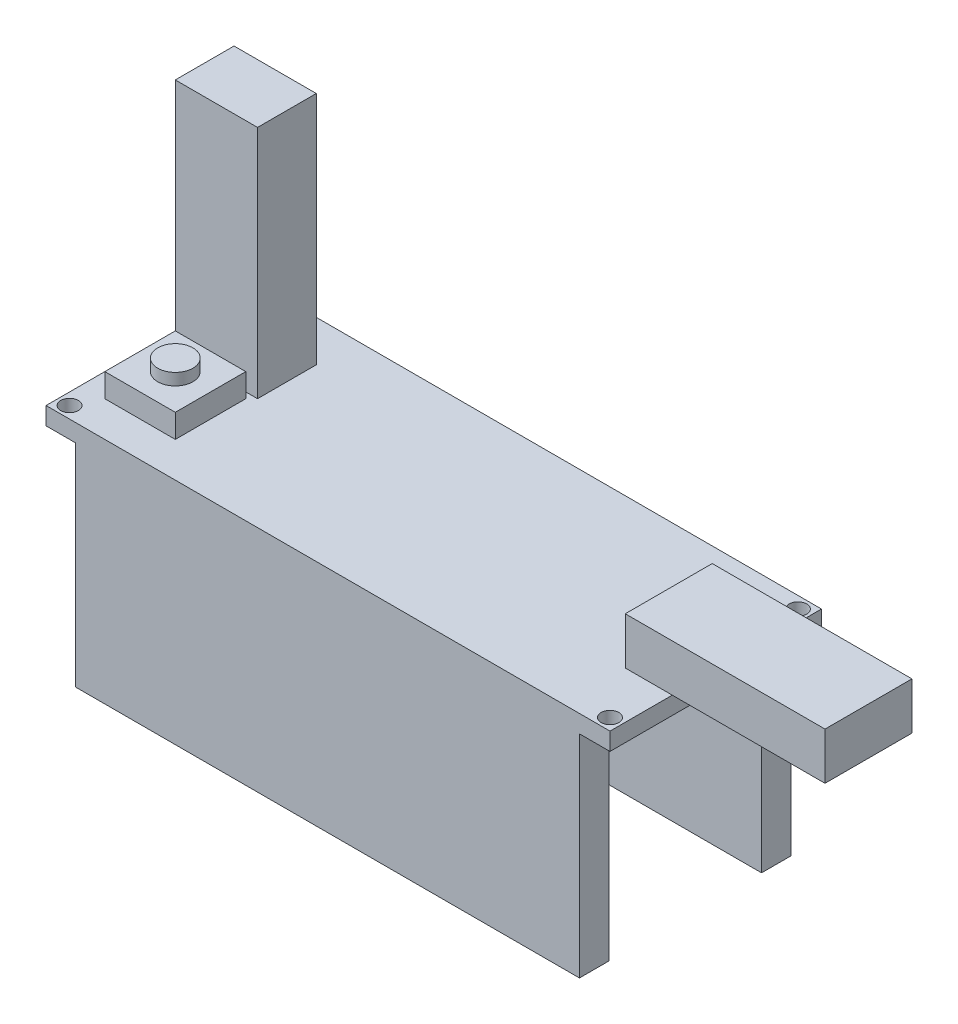
from build123d import *

# Parameters (mm, degrees)
SKETCH_1_W          = 48
SKETCH_1_H          = 18
EXTRUDE_1_DEPTH     = 1.5
SKETCH_2_W          = 17
SKETCH_2_H          = 7.4
EXTRUDE_2_DEPTH     = 4
SKETCH_4_W          = 42.9
SKETCH_4_H          = 2.5
EXTRUDE_3_DEPTH     = 18
SKETCH_5_W          = 7
SKETCH_5_H          = 5
EXTRUDE_4_DEPTH     = 20
SKETCH_6_W          = 6
SKETCH_6_H          = 6
EXTRUDE_5_DEPTH     = 2
SKETCH_7_R          = 1.5
EXTRUDE_6_DEPTH     = 1
SKETCH_8_R          = 0.75
CUT_EXTRUDE_1_DEPTH = 10


with BuildPart() as part:
    # Эскиз1 → Бобышка-Вытянуть1 (new body)
    with BuildSketch(Plane(origin=(0, 0, 0), x_dir=(1, 0, 0), z_dir=(0, 1, 0))):
        with Locations((-24, 9)):
            Rectangle(SKETCH_1_W, SKETCH_1_H)
    extrude(amount=EXTRUDE_1_DEPTH)

    # Эскиз2 → Бобышка-Вытянуть2 (add)
    with BuildSketch(Plane(origin=(0, 1.5, 0), x_dir=(1, 0, 0), z_dir=(0, 1, 0))):
        with Locations((4.5, 9)):
            Rectangle(SKETCH_2_W, SKETCH_2_H)
    extrude(amount=EXTRUDE_2_DEPTH)

    # Эскиз4 → Бобышка-Вытянуть3 (add)
    with BuildSketch(Plane(origin=(0, 0, 0), x_dir=(-1, 0, 0), z_dir=(0, -1, 0))):
        with Locations((24.05, 16.75)):
            Rectangle(SKETCH_4_W, SKETCH_4_H)
        with Locations((24.05, 1.25)):
            Rectangle(SKETCH_4_W, SKETCH_4_H)
    extrude(amount=EXTRUDE_3_DEPTH)

    # Эскиз5 → Бобышка-Вытянуть4 (add)
    with BuildSketch(Plane(origin=(0, 1.5, 0), x_dir=(1, 0, 0), z_dir=(0, 1, 0))):
        with Locations((-43, 12)):
            Rectangle(SKETCH_5_W, SKETCH_5_H)
    extrude(amount=EXTRUDE_4_DEPTH)

    # Эскиз6 → Бобышка-Вытянуть5 (add)
    with BuildSketch(Plane(origin=(0, 1.5, 0), x_dir=(1, 0, 0), z_dir=(0, 1, 0))):
        with Locations((-43, 6)):
            Rectangle(SKETCH_6_W, SKETCH_6_H)
    extrude(amount=EXTRUDE_5_DEPTH)

    # Эскиз7 → Бобышка-Вытянуть6 (add)
    with BuildSketch(Plane(origin=(0, 3.5, 0), x_dir=(1, 0, 0), z_dir=(0, 1, 0))):
        with Locations((-43, 6)):
            Circle(SKETCH_7_R)
    extrude(amount=EXTRUDE_6_DEPTH)

    # Эскиз8 → Вырез-Вытянуть1 (cut)
    with BuildSketch(Plane(origin=(0, 1.5, 0), x_dir=(1, 0, 0), z_dir=(0, 1, 0))):
        with Locations((-47, 17)):
            Circle(SKETCH_8_R)
        with Locations((-47, 1)):
            Circle(SKETCH_8_R)
        with Locations((-1, 1)):
            Circle(SKETCH_8_R)
        with Locations((-1, 17)):
            Circle(SKETCH_8_R)
    extrude(amount=-CUT_EXTRUDE_1_DEPTH, mode=Mode.SUBTRACT)


solid = part.part
